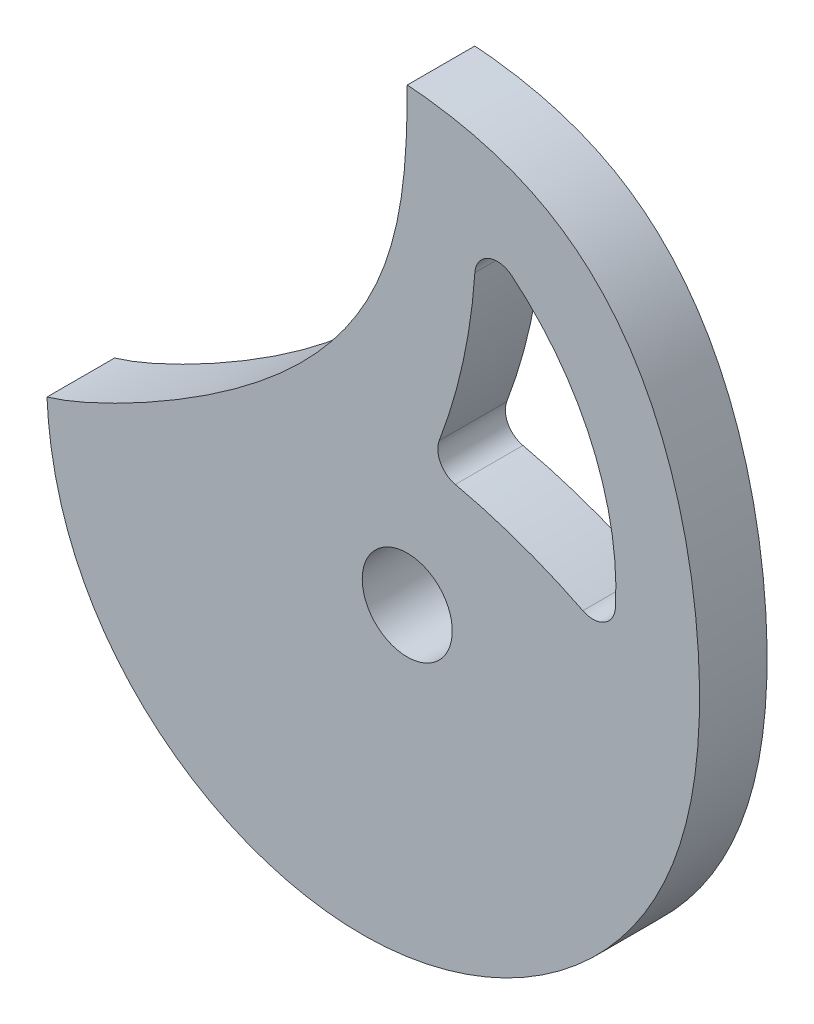
from build123d import *

# Parameters (mm, degrees)
SKETCH1_R           = 12.7
BOSS_EXTRUDE1_DEPTH = 19.05


with BuildPart() as part:
    # Sketch1 → Boss-Extrude1 (new body)
    with BuildSketch(Plane(origin=(0, 0, 0), x_dir=(-1, 0, 0), z_dir=(0, 0, -1))):
        with BuildLine():
            add(Edge.make_bspline(
                [(101.6, 0), (101.32208867, -6.136488525), (99.965807152, -17.952949824), (95.529874176, -34.308259364), (85.074625768, -53.243582505), (65.991426873, -71.430324737), (42.986480868, -83.333396889), (18.270870089, -88.387072092), (-6.080373441, -86.433983418), (-28.770430703, -78.329979357), (-48.625489626, -65.160533517), (-64.506059429, -47.92429245), (-75.654946743, -27.560711681), (-81.728973879, -4.938917232), (-83.304972238, 19.372312845), (-81.401658445, 44.656591936), (-75.889556202, 69.105898036), (-66.571386811, 90.740483473), (-53.353364798, 107.75154214), (-36.946563703, 119.046068508), (-18.981285454, 124.816190327), (-7.107980708, 126.450303588), (-1.840493437, 126.899964589), (-0.28711634, 127), (0, 127)],
                knots=[-1, -1, -1, -1, -1, -1, -0.95, -0.9, -0.85, -0.8, -0.75, -0.7, -0.65, -0.6, -0.55, -0.5, -0.45, -0.4, -0.35, -0.3, -0.25, -0.2, -0.15, -0.1, -0.05, 0, 0, 0, 0, 0, 0], degree=5))
            add(Edge.make_bspline(
                [(0, 127), (0, 125.478820477), (0.017668576, 122.257003221), (0.0972057, 116.885922928), (0.398911953, 108.719650428), (1.597057917, 97.258110232), (4.205074859, 85.094095292), (8.737985203, 72.807961005), (15.443291014, 60.901238952), (24.156375536, 49.713603466), (34.445644593, 39.469197718), (45.707336285, 30.301519137), (57.269406734, 22.280731267), (68.481604879, 15.434066219), (78.816351629, 9.763823916), (87.948221573, 5.261047508), (94.144249466, 2.583421629), (98.130881968, 1.091339634), (100.492913455, 0.32561369), (101.6, 0)],
                knots=[0, 0, 0, 0, 0, 0, 0.066666667, 0.133333333, 0.2, 0.266666667, 0.333333333, 0.4, 0.466666667, 0.533333333, 0.6, 0.666666667, 0.733333333, 0.8, 0.866666667, 0.933333333, 1, 1, 1, 1, 1, 1], degree=5))
        make_face()
        Circle(SKETCH1_R, mode=Mode.SUBTRACT)
        with BuildLine():
            ThreePointArc((-58.707286474, 28.704291043), (-52.047081401, 65.466533842), (-29.419483182, 95.195520137))
            ThreePointArc((-29.419483182, 95.195520137), (-22.875714103, 96.100904583), (-19.06862847, 90.702133081))
            ThreePointArc((-19.06862847, 90.702133081), (-15.748701126, 67.316990393), (-9.022187948, 44.675417202))
            ThreePointArc((-9.022187948, 44.675417202), (-9.365569099, 39.416971387), (-13.561125707, 36.228481503))
            ThreePointArc((-13.561125707, 36.228481503), (-31.932324156, 30.89594831), (-49.525218191, 23.384162759))
            ThreePointArc((-49.525218191, 23.384162759), (-55.550862543, 23.568217262), (-58.707286474, 28.704291043))
        make_face(mode=Mode.SUBTRACT)
    extrude(amount=-BOSS_EXTRUDE1_DEPTH)


solid = part.part
